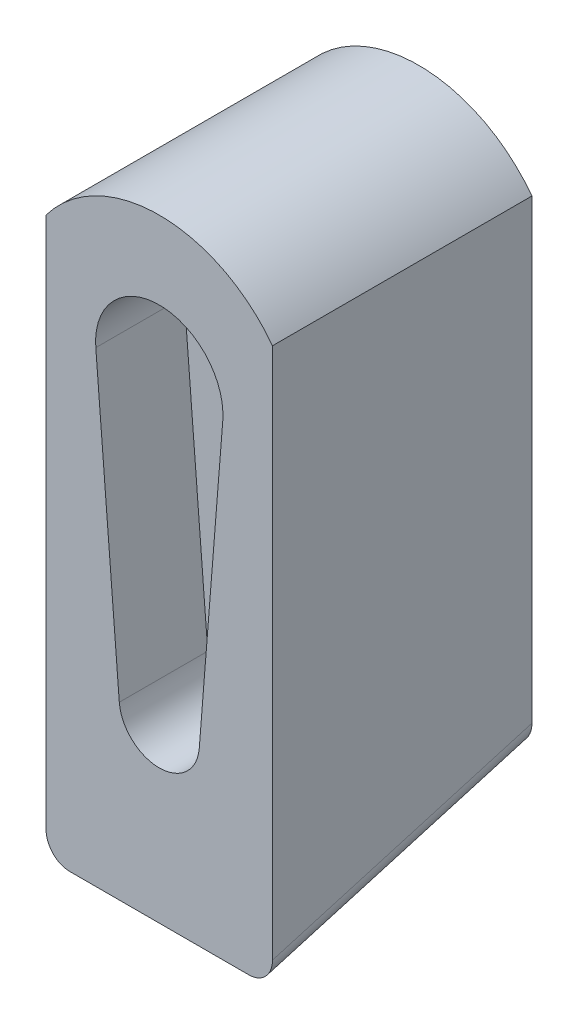
from build123d import *

# Parameters (mm, degrees)
BOSS_EXTRUDE1_DEPTH     = 13.97
CUT_EXTRUDE1_DEPTH      = 37.83
CUT_EXTRUDE1_DEPTH_BACK = 4.7625
CUT_EXTRUDE2_DEPTH      = 39.31360787
SKETCH4_R               = 1.5875
CUT_EXTRUDE3_DEPTH      = 28.696557047
SKETCH5_R               = 3.175
CUT_EXTRUDE4_DEPTH      = 6.35
CHAMFER1_SIZE           = 1.016
FILLET1_R               = 1.27


with BuildPart() as part:
    # Sketch1 → Boss-Extrude1 (new body)
    with BuildSketch(Plane.XY):
        with BuildLine():
            Line((-6.096, 4.572), (-6.096, -33.528))
            Line((-6.096, -33.528), (6.096, -33.528))
            Line((6.096, -33.528), (6.096, 4.572))
            ThreePointArc((6.096, 4.572), (0, 7.62), (-6.096, 4.572))
        make_face()
    extrude(amount=BOSS_EXTRUDE1_DEPTH)

    # Sketch2 → Cut-Extrude1 (cut, two sides: drawn at the far end of the back side and taken through both)
    with BuildSketch(Plane.XY.offset(13.97).offset(-CUT_EXTRUDE1_DEPTH_BACK)):
        with BuildLine():
            Line((3.418183621, -0.272142857), (2.152189687, -16.173349206))
            ThreePointArc((2.152189687, -16.173349206), (0, -18.161), (-2.152189687, -16.173349206))
            Line((-2.152189687, -16.173349206), (-3.418183621, -0.272142857))
            ThreePointArc((-3.418183621, -0.272142857), (0, 3.429), (3.418183621, -0.272142857))
        make_face()
    extrude(amount=CUT_EXTRUDE1_DEPTH + CUT_EXTRUDE1_DEPTH_BACK, mode=Mode.SUBTRACT)

    # Sketch3 → Cut-Extrude2 (cut, through all)
    with BuildSketch(Plane(origin=(6.096, 0, 0), x_dir=(0, 0, -1), z_dir=(1, 0, 0))):
        Polygon((-13.97, -33.528), (-13.97, -25.4), (0, -21.336), (0, -33.528), align=None)
    extrude(amount=-CUT_EXTRUDE2_DEPTH, mode=Mode.SUBTRACT)

    # Sketch4 → Cut-Extrude3 (cut, through all)
    with BuildSketch(Plane.XY.offset(9.2075)):
        Circle(SKETCH4_R)
    extrude(amount=-CUT_EXTRUDE3_DEPTH, mode=Mode.SUBTRACT)

    # Sketch5 → Cut-Extrude4 (cut)
    with BuildSketch(Plane(origin=(0, 0, 0), x_dir=(-1, 0, 0), z_dir=(0, 0, -1))):
        Circle(SKETCH5_R)
    extrude(amount=-CUT_EXTRUDE4_DEPTH, mode=Mode.SUBTRACT)

    # Chamfer1
    chamfer1_edges = [part.edges().sort_by_distance(p)[0] for p in [
        (3.175, 0, 6.35),
    ]]
    chamfer(chamfer1_edges, length=CHAMFER1_SIZE)

    # Fillet1
    fillet1_edges = [part.edges().sort_by_distance(p)[0] for p in [
        (-6.096, -23.368, 6.985),
        (6.096, -23.368, 6.985),
    ]]
    fillet(fillet1_edges, radius=FILLET1_R)


solid = part.part
